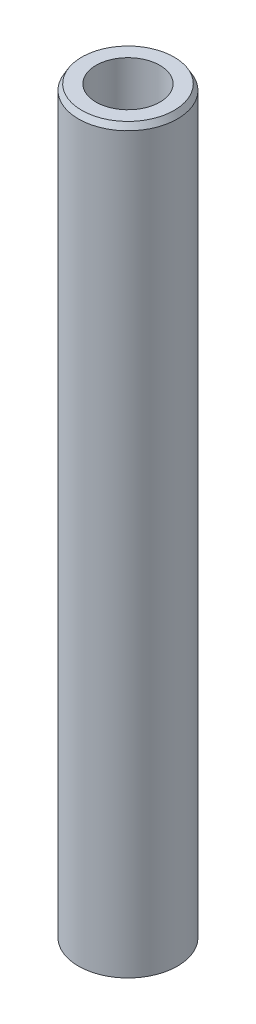
from build123d import *
from OCP.BRepFilletAPI import BRepFilletAPI_MakeChamfer

# Parameters (mm, degrees)
SKETCH1_R           = 40
BOSS_EXTRUDE1_DEPTH = 600
SKETCH2_R           = 25.794841621
CUT_EXTRUDE1_DEPTH  = 603.660766933
CHAMFER1_SIZE       = 4.647097224
CHAMFER1_SIZE2      = 2.683002833


with BuildPart() as part:
    # Sketch1 → Boss-Extrude1 (new body)
    with BuildSketch(Plane(origin=(0, 0, 0), x_dir=(1, 0, 0), z_dir=(0, 1, 0))):
        Circle(SKETCH1_R)
    extrude(amount=BOSS_EXTRUDE1_DEPTH)

    # Sketch2 → Cut-Extrude1 (cut, through all)
    with BuildSketch(Plane(origin=(0, 0, 0), x_dir=(1, 0, 0), z_dir=(0, 1, 0))):
        Circle(SKETCH2_R)
    extrude(amount=CUT_EXTRUDE1_DEPTH, mode=Mode.SUBTRACT)

    # Chamfer1: one chamfer whose edges measure the first distance from different faces: ONE call of the kernel's chamfer builder (chamfer() names one face for all edges)
    chamfer1_edges_1 = [part.edges().sort_by_distance(p)[0] for p in [
        (-40, 600, 0),
    ]]
    chamfer1_side_1 = [part.faces().sort_by_distance(p)[0] for p in [
        (-40, 300, 0),
    ]]
    chamfer1_edges_2 = [part.edges().sort_by_distance(p)[0] for p in [
        (-40, 0, 0),
    ]]
    chamfer1_side_2 = [part.faces().sort_by_distance(p)[0] for p in [
        (-38.86862915, 0, 0),
    ]]
    chamfer1 = BRepFilletAPI_MakeChamfer(part.part.solid().wrapped)
    for e in chamfer1_edges_1:
        chamfer1.Add(CHAMFER1_SIZE, CHAMFER1_SIZE2, e.wrapped, chamfer1_side_1[0].wrapped)  # the first distance lies on this face
    for e in chamfer1_edges_2:
        chamfer1.Add(CHAMFER1_SIZE, CHAMFER1_SIZE2, e.wrapped, chamfer1_side_2[0].wrapped)  # the first distance lies on this face
    add(Compound.cast(chamfer1.Shape()), mode=Mode.REPLACE)


solid = part.part
